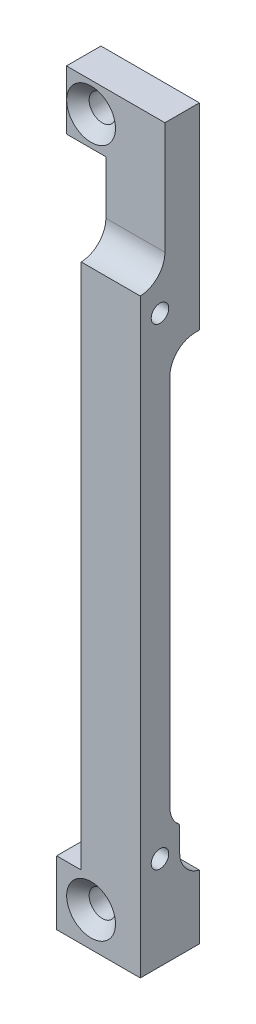
from build123d import *

# Parameters (mm, degrees)
BOSS_EXTRUDE1_DEPTH                             = 7.62
SKETCH11_W                                      = 17.78
SKETCH11_H                                      = 17.78
CUT_EXTRUDE1_DEPTH                              = 3.175
SKETCH12_W                                      = 3.81
SKETCH12_H                                      = 60.325
CUT_EXTRUDE2_DEPTH                              = 96.139869666
SKETCH14_W                                      = 7.62
SKETCH14_H                                      = 8.255
BOSS_EXTRUDE3_DEPTH                             = 3.175
SKETCH24_W                                      = 7.62
SKETCH24_H                                      = 6.35
BOSS_EXTRUDE4_DEPTH                             = 1.27
CSK_FOR_M3_FLAT_HEAD_MACHINE_SCREW2_D           = 3.4
CSK_FOR_M3_FLAT_HEAD_MACHINE_SCREW2_CSINK_D     = 6.3
CSK_FOR_M3_FLAT_HEAD_MACHINE_SCREW2_CSINK_ANGLE = 90
CSK_FOR_M3_FLAT_HEAD_MACHINE_SCREW3_D           = 3.4
CSK_FOR_M3_FLAT_HEAD_MACHINE_SCREW3_CSINK_D     = 6.3
CSK_FOR_M3_FLAT_HEAD_MACHINE_SCREW3_CSINK_ANGLE = 90
F_4_40_TAPPED_HOLE2_D                           = 2.2606
F_4_40_TAPPED_HOLE2_DEPTH                       = 8.8646
F_4_40_TAPPED_HOLE2_TIP                         = 0.679152758
SKETCH25_W                                      = 5.08
SKETCH25_H                                      = 93.98
CUT_EXTRUDE3_DEPTH                              = 96.139869666
FILLET1_R                                       = 3.302


with BuildPart() as part:
    # Sketch1 → Boss-Extrude1 (new body)
    with BuildSketch(Plane.XY):
        Polygon((0, -93.98), (0, -7.62), (-5.08, -7.62), (-5.08, 0), (12.7, 0), (12.7, -7.62), (7.62, -7.62), (7.62, -93.98), align=None)
    extrude(amount=BOSS_EXTRUDE1_DEPTH)

    # Sketch11 → Cut-Extrude1 (cut)
    with BuildSketch(Plane.XY.offset(7.62)):
        with Locations((3.81, -8.89)):
            Rectangle(SKETCH11_W, SKETCH11_H)
    extrude(amount=-CUT_EXTRUDE1_DEPTH, mode=Mode.SUBTRACT)

    # Sketch12 → Cut-Extrude2 (cut, through all)
    with BuildSketch(Plane(origin=(7.62, 0, 0), x_dir=(0, 0, -1), z_dir=(1, 0, 0))):
        with Locations((-1.905, -55.5625)):
            Rectangle(SKETCH12_W, SKETCH12_H)
    extrude(amount=-CUT_EXTRUDE2_DEPTH, mode=Mode.SUBTRACT)

    # Sketch14 → Boss-Extrude3 (add)
    with BuildSketch(Plane(origin=(7.62, 0, 0), x_dir=(0, 0, -1), z_dir=(1, 0, 0))):
        with Locations((-3.81, -89.8525)):
            Rectangle(SKETCH14_W, SKETCH14_H)
    boss_extrude3 = extrude(amount=BOSS_EXTRUDE3_DEPTH)

    # Mirror1: Boss-Extrude3 across plane
    add(boss_extrude3.mirror(Plane(origin=(3.81, 0, 0), x_dir=(0, 0, 1), z_dir=(1, 0, 0))))

    # Sketch24 → Boss-Extrude4 (add)
    with BuildSketch(Plane(origin=(0, 0, 3.81), x_dir=(-1, 0, 0), z_dir=(0, 0, -1))):
        with Locations((-3.81, -82.55)):
            Rectangle(SKETCH24_W, SKETCH24_H)
    extrude(amount=BOSS_EXTRUDE4_DEPTH)

    # CSK for M3 Flat Head Machine Screw2 (through all)
    with Locations(Plane.XY.offset(7.62)):
        with Locations((1.27, -89.535)):
            CounterSinkHole(CSK_FOR_M3_FLAT_HEAD_MACHINE_SCREW2_D / 2, CSK_FOR_M3_FLAT_HEAD_MACHINE_SCREW2_CSINK_D / 2, counter_sink_angle=CSK_FOR_M3_FLAT_HEAD_MACHINE_SCREW2_CSINK_ANGLE)

    # CSK for M3 Flat Head Machine Screw3 (through all)
    with Locations(Plane.XY.offset(4.445)):
        with Locations((-1.905, -3.81)):
            CounterSinkHole(CSK_FOR_M3_FLAT_HEAD_MACHINE_SCREW3_D / 2, CSK_FOR_M3_FLAT_HEAD_MACHINE_SCREW3_CSINK_D / 2, counter_sink_angle=CSK_FOR_M3_FLAT_HEAD_MACHINE_SCREW3_CSINK_ANGLE)

    # #4-40 Tapped Hole2
    with Locations(Plane(origin=(7.62, 0, 0), x_dir=(0, 0, -1), z_dir=(1, 0, 0))):
        with Locations((-5.08, -20.9677), (-5.08, -81.9277)):
            Hole(F_4_40_TAPPED_HOLE2_D / 2, depth=F_4_40_TAPPED_HOLE2_DEPTH)
            with Locations((0, 0, -(F_4_40_TAPPED_HOLE2_DEPTH + F_4_40_TAPPED_HOLE2_TIP / 2))):  # 118° drill point
                Cone(0, F_4_40_TAPPED_HOLE2_D / 2, F_4_40_TAPPED_HOLE2_TIP, mode=Mode.SUBTRACT)

    # Sketch25 → Cut-Extrude3 (cut, through all)
    with BuildSketch(Plane(origin=(0, 0, 0), x_dir=(-1, 0, 0), z_dir=(0, 0, -1))):
        with Locations((-10.16, -46.99)):
            Rectangle(SKETCH25_W, SKETCH25_H)
    extrude(amount=-CUT_EXTRUDE3_DEPTH, mode=Mode.SUBTRACT)

    # Fillet1
    # the kernel refuses this fillet: 3.302 mm, written as the material it adds along each edge
    with BuildSketch(Plane(origin=(7.62, -85.725, 2.54), x_dir=(0, 0, -1), z_dir=(-1, 0, 0))) as fillet1_piece_1:
        with BuildLine():
            CenterArc((3.302, -3.212874103), FILLET1_R, 103.342363797, 76.657636203)
            Line((0, -3.212874103), (-0.06604, -3.212874103))
            Line((-0.06604, -3.212874103), (-0.06604, 0))
            Line((-0.06604, 0), (0, 0.06604))
            ThreePointArc((0, 0.06604), (1.27, 0.06604), (2.52476, 0.064257482))
            Line((2.52476, 0.064257482), (2.54, 0))
        make_face()
    extrude(amount=7.62)
    with BuildSketch(Plane(origin=(0, -79.375, 3.81), x_dir=(0, 0, -1), z_dir=(1, 0, 0))) as fillet1_piece_2:
        with BuildLine():
            CenterArc((3.302, 2.602725495), FILLET1_R, 180, 52.020127555)
            Line((0, 2.602725495), (-0.06604, 2.602725495))
            Line((-0.06604, 2.602725495), (-0.06604, 0))
            Line((-0.06604, 0), (0, -0.06604))
            ThreePointArc((0, -0.06604), (0.635, -0.06604), (1.22936, -0.05205451))
            Line((1.22936, -0.05205451), (1.27, 0))
        make_face()
    extrude(amount=7.62)
    with BuildSketch(Plane(origin=(7.62, -25.4, 3.81), x_dir=(0, 0, -1), z_dir=(-1, 0, 0))) as fillet1_piece_3:
        with BuildLine():
            CenterArc((FILLET1_R, FILLET1_R), FILLET1_R, 180, 90)
            Line((0, FILLET1_R), (-FILLET1_R * 0.02, FILLET1_R))
            Line((-FILLET1_R * 0.02, FILLET1_R), (-FILLET1_R * 0.02, -FILLET1_R * 0.02))
            Line((-FILLET1_R * 0.02, -FILLET1_R * 0.02), (FILLET1_R, -FILLET1_R * 0.02))
            Line((FILLET1_R, -FILLET1_R * 0.02), (FILLET1_R, 0))
        make_face()
    extrude(amount=7.62)
    with BuildSketch(Plane(origin=(7.62, -17.78, 4.445), x_dir=(0, 0, 1), z_dir=(-1, 0, 0))) as fillet1_piece_4:
        with BuildLine():
            CenterArc((3.302, 3.299556788), FILLET1_R, 180, 87.795772496)
            Line((0, 3.299556788), (-0.06604, 3.299556788))
            Line((-0.06604, 3.299556788), (-0.06604, 0))
            Line((-0.06604, 0), (0, -0.06604))
            ThreePointArc((0, -0.06604), (1.5875, -0.06604), (3.17246, -0.065991136))
            Line((3.17246, -0.065991136), (3.175, 0))
        make_face()
    extrude(amount=7.62)


solid = part.part
